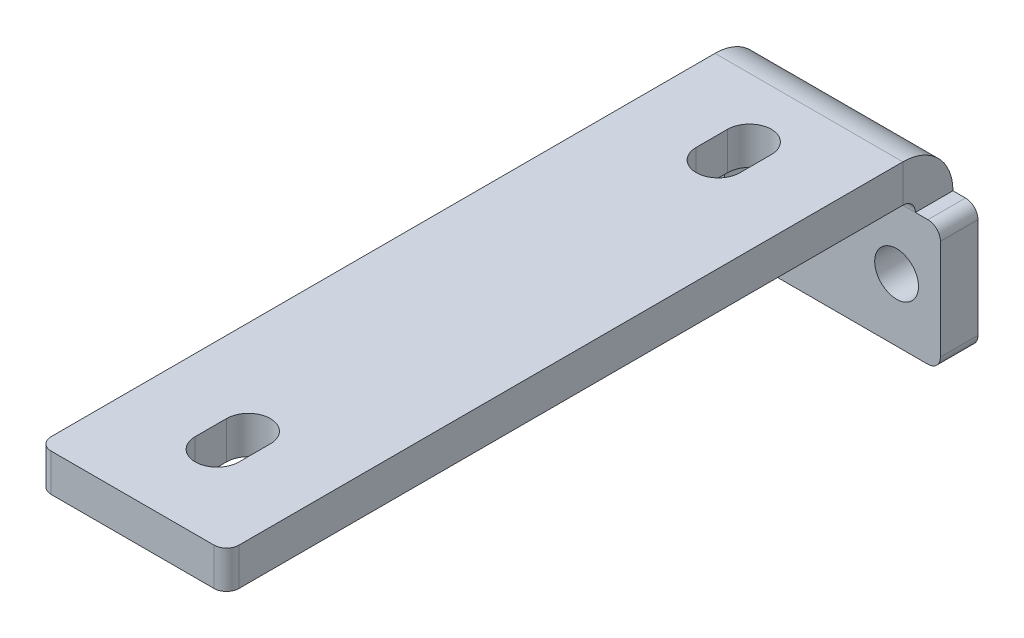
from build123d import *

# Parameters (mm, degrees)
CROQUIS1_W             = 19
CROQUIS1_H             = 10
CROQUIS1_R             = 1.75
BRIDA_BASE1_DEPTH      = 3
BRIDA_DE_ARISTA1_DEPTH = 15
CORTAR_EXTRUIR1_REACH  = 61.85
REDONDEO1_R            = 1


# Sheet-metal steps are written as plain solids
with BuildPart() as part:
    # Croquis1 → Brida base1 (new body)
    with BuildSketch(Plane.XY):
        with Locations((9.5, -5)):
            Rectangle(CROQUIS1_W, CROQUIS1_H)
        with Locations((3.5, -5)):
            Circle(CROQUIS1_R, mode=Mode.SUBTRACT)
        with Locations(Location((15.5, -5, 0), (0, 0, 180))):
            Circle(CROQUIS1_R, mode=Mode.SUBTRACT)
    extrude(amount=-BRIDA_BASE1_DEPTH)

    # Brida de arista1 section (across the edge) → Brida de arista1 (add)
    with BuildSketch(Plane(origin=(17, 1, 0), x_dir=(0, -1, 0), z_dir=(-1, 0, 0))):
        with BuildLine():
            Line((-3, 1), (-3, 55))
            Line((-3, 55), (0, 55))
            Line((0, 55), (0, 1))
            ThreePointArc((0, 1), (0.292893219, 0.292893219), (1, 0))
            Line((1, 0), (1, -3))
            ThreePointArc((1, -3), (-1.828427125, -1.828427125), (-3, 1))
        make_face()
    extrude(amount=BRIDA_DE_ARISTA1_DEPTH)

    # Croquis9 → Cortar-Extruir1 (cut, up to next)
    with BuildSketch(Plane(origin=(0, 4, 0), x_dir=(1, 0, 0), z_dir=(0, 1, 0)), mode=Mode.PRIVATE) as cortar_extruir1_sk1:
        with BuildLine():
            Line((7.75, -8.25), (7.75, -5.75))
            ThreePointArc((7.75, -5.75), (9.5, -4), (11.25, -5.75))
            Line((11.25, -5.75), (11.25, -8.25))
            ThreePointArc((11.25, -8.25), (9.5, -10), (7.75, -8.25))
        make_face()
    cortar_extruir1_tool1 = extrude(cortar_extruir1_sk1.sketch, amount=-CORTAR_EXTRUIR1_REACH, mode=Mode.PRIVATE) & part.part
    # Croquis9 → Cortar-Extruir1 (cut, up to next)
    with BuildSketch(Plane(origin=(0, 4, 0), x_dir=(1, 0, 0), z_dir=(0, 1, 0)), mode=Mode.PRIVATE) as cortar_extruir1_sk2:
        with BuildLine():
            Line((7.75, -48.25), (7.75, -45.75))
            ThreePointArc((7.75, -45.75), (9.5, -44), (11.25, -45.75))
            Line((11.25, -45.75), (11.25, -48.25))
            ThreePointArc((11.25, -48.25), (9.5, -50), (7.75, -48.25))
        make_face()
    cortar_extruir1_tool2 = extrude(cortar_extruir1_sk2.sketch, amount=-CORTAR_EXTRUIR1_REACH, mode=Mode.PRIVATE) & part.part
    add(cortar_extruir1_tool1.solids().sort_by_distance((9.5, 4, 7))[0], mode=Mode.SUBTRACT)
    add(cortar_extruir1_tool2.solids().sort_by_distance((9.5, 4, 47))[0], mode=Mode.SUBTRACT)

    # Redondeo1
    redondeo1_edges = [part.edges().sort_by_distance(p)[0] for p in [
        (19, -10, -1.5),
        (0, -10, -1.5),
        (19, 0, -1.5),
        (0, 0, -1.5),
        (17, 2.5, 55),
        (2, 2.5, 55),
    ]]
    fillet(redondeo1_edges, radius=REDONDEO1_R)


solid = part.part
